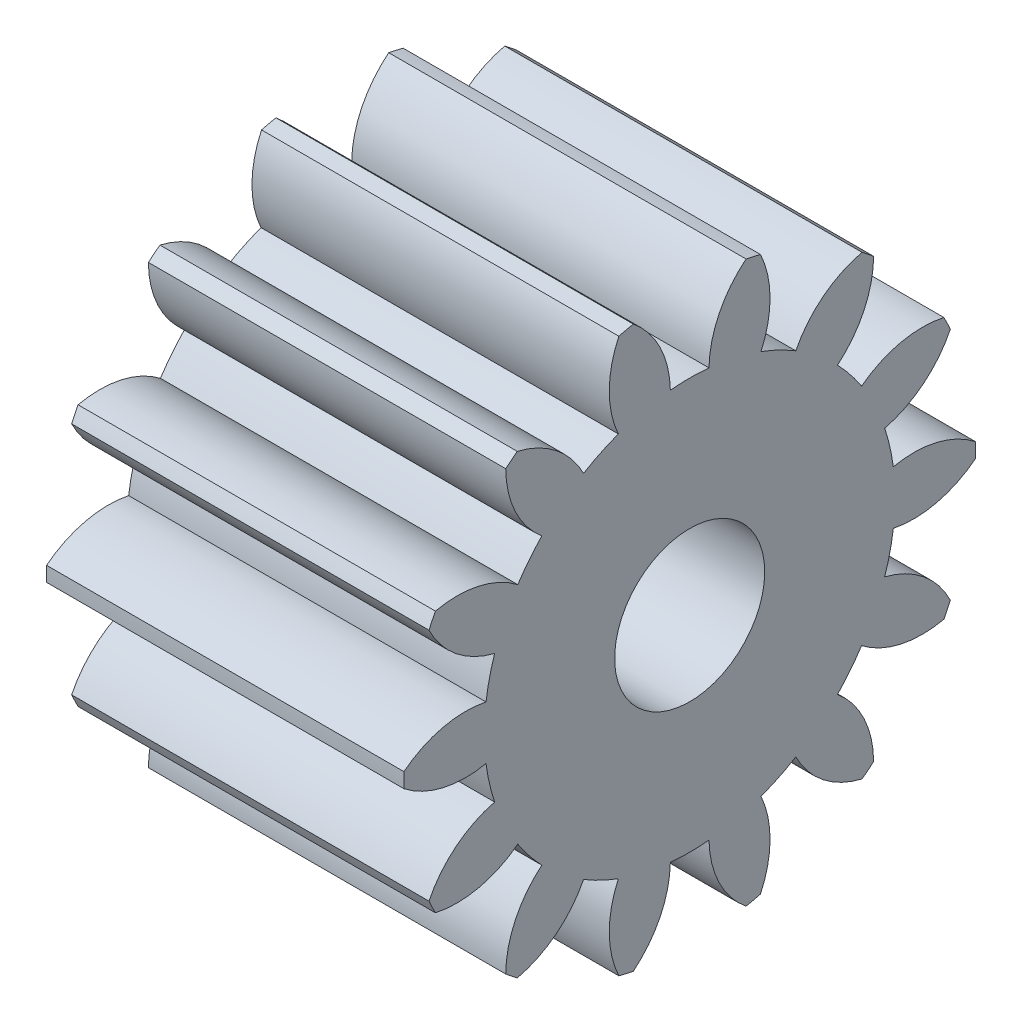
from build123d import *

# Parameters (mm, degrees)
SPUR_START             = 15.199213342
SPUR_GEAR_AM_OUTLINE_R = 2.5
SPUR_GEAR_AM_DEPTH     = 5
SKETCH9_R              = 2.5
SKETCH9_R_2            = 1.05
BOSS_EXTRUDE1_DEPTH    = 5


# Read off the part's stored shape, not the designer's step: spur gear_am
with BuildPart() as part:
    # spur gear_am outline → spur gear_am (new body)
    with BuildSketch(Plane.YZ.offset(SPUR_START)):
        with BuildLine():
            ThreePointArc((2.747947228, -4.643773619), (2.654088149, -4.687486435), (2.561391914, -4.733613923))
            ThreePointArc((2.561391914, -4.733613923), (2.561783739, -5.337982285), (2.816889806, -5.88587111))
            ThreePointArc((2.816889806, -5.88587111), (2.597713415, -6.044378226), (2.394409068, -6.222788256))
            ThreePointArc((2.394409068, -6.222788256), (1.9170234, -5.852161498), (1.327895004, -5.717294884))
            ThreePointArc((1.327895004, -5.717294884), (1.262297175, -5.797402699), (1.198794721, -5.879181519))
            ThreePointArc((1.198794721, -5.879181519), (1.461373347, -6.423528591), (1.928936024, -6.806472991))
            ThreePointArc((1.928936024, -6.806472991), (1.800238579, -7.04438004), (1.694476903, -7.293332374))
            ThreePointArc((1.694476903, -7.293332374), (1.103558354, -7.166539081), (0.514255579, -7.300641692))
            ThreePointArc((0.514255579, -7.300641692), (0.489911456, -7.401278171), (0.468180222, -7.502511024))
            ThreePointArc((0.468180222, -7.502511024), (0.940938733, -7.879022193), (1.528351497, -8.021175333))
            ThreePointArc((1.528351497, -8.021175333), (1.515623105, -8.291361907), (1.528351497, -8.56154848))
            ThreePointArc((1.528351497, -8.56154848), (0.940938733, -8.70370162), (0.468180222, -9.080212789))
            ThreePointArc((0.468180222, -9.080212789), (0.489911456, -9.181445642), (0.514255579, -9.28208212))
            ThreePointArc((0.514255579, -9.28208212), (1.103558354, -9.416184732), (1.694476903, -9.289391439))
            ThreePointArc((1.694476903, -9.289391439), (1.800238579, -9.538343772), (1.928936024, -9.776250821))
            ThreePointArc((1.928936024, -9.776250821), (1.461373347, -10.159195221), (1.198794721, -10.703542294))
            ThreePointArc((1.198794721, -10.703542294), (1.262297175, -10.785321114), (1.327895004, -10.865428928))
            ThreePointArc((1.327895004, -10.865428928), (1.9170234, -10.730562315), (2.394409068, -10.359935556))
            ThreePointArc((2.394409068, -10.359935556), (2.597713414, -10.538345587), (2.816889806, -10.696852703))
            ThreePointArc((2.816889806, -10.696852703), (2.561783739, -11.244741528), (2.561391914, -11.84910989))
            ThreePointArc((2.561391914, -11.84910989), (2.654088149, -11.895237378), (2.747947228, -11.938950194))
            ThreePointArc((2.747947228, -11.938950194), (3.220217142, -11.561826343), (3.489517843, -11.020773293))
            ThreePointArc((3.489517843, -11.020773293), (3.750097941, -11.093304726), (4.016342706, -11.14101763))
            ThreePointArc((4.016342706, -11.14101763), (4.024220134, -11.745334779), (4.286092716, -12.290021864))
            ThreePointArc((4.286092716, -12.290021864), (4.389623105, -12.291361906), (4.493153494, -12.290021864))
            ThreePointArc((4.493153494, -12.290021864), (4.755026076, -11.745334779), (4.762903504, -11.14101763))
            ThreePointArc((4.762903504, -11.14101763), (5.029148269, -11.093304726), (5.289728367, -11.020773293))
            ThreePointArc((5.289728367, -11.020773293), (5.559029068, -11.561826343), (6.031298982, -11.938950194))
            ThreePointArc((6.031298982, -11.938950194), (6.125158061, -11.895237378), (6.217854296, -11.84910989))
            ThreePointArc((6.217854296, -11.84910989), (6.217462471, -11.244741528), (5.962356404, -10.696852703))
            ThreePointArc((5.962356404, -10.696852703), (6.181532796, -10.538345587), (6.384837142, -10.359935556))
            ThreePointArc((6.384837142, -10.359935556), (6.86222281, -10.730562315), (7.451351206, -10.865428928))
            ThreePointArc((7.451351206, -10.865428928), (7.516949035, -10.785321114), (7.580451489, -10.703542294))
            ThreePointArc((7.580451489, -10.703542294), (7.317872863, -10.159195221), (6.850310186, -9.776250821))
            ThreePointArc((6.850310186, -9.776250821), (6.979007631, -9.538343772), (7.084769307, -9.289391439))
            ThreePointArc((7.084769307, -9.289391439), (7.675687856, -9.416184732), (8.26499063, -9.28208212))
            ThreePointArc((8.26499063, -9.28208212), (8.289334754, -9.181445642), (8.311065988, -9.080212789))
            ThreePointArc((8.311065988, -9.080212789), (7.838307477, -8.70370162), (7.250894713, -8.56154848))
            ThreePointArc((7.250894713, -8.56154848), (7.263623105, -8.291361907), (7.250894713, -8.021175333))
            ThreePointArc((7.250894713, -8.021175333), (7.838307477, -7.879022193), (8.311065988, -7.502511024))
            ThreePointArc((8.311065988, -7.502511024), (8.289334754, -7.40127817), (8.26499063, -7.300641692))
            ThreePointArc((8.26499063, -7.300641692), (7.675687856, -7.166539081), (7.084769307, -7.293332374))
            ThreePointArc((7.084769307, -7.293332374), (6.979007631, -7.04438004), (6.850310186, -6.806472991))
            ThreePointArc((6.850310186, -6.806472991), (7.317872863, -6.423528591), (7.580451489, -5.879181519))
            ThreePointArc((7.580451489, -5.879181519), (7.516949035, -5.797402699), (7.451351206, -5.717294884))
            ThreePointArc((7.451351206, -5.717294884), (6.86222281, -5.852161498), (6.384837142, -6.222788256))
            ThreePointArc((6.384837142, -6.222788256), (6.181532795, -6.044378226), (5.962356404, -5.88587111))
            ThreePointArc((5.962356404, -5.88587111), (6.217462471, -5.337982285), (6.217854296, -4.733613923))
            ThreePointArc((6.217854296, -4.733613923), (6.125158061, -4.687486435), (6.031298982, -4.643773619))
            ThreePointArc((6.031298982, -4.643773619), (5.559029068, -5.02089747), (5.289728367, -5.56195052))
            ThreePointArc((5.289728367, -5.56195052), (5.029148269, -5.489419087), (4.762903504, -5.441706183))
            ThreePointArc((4.762903504, -5.441706183), (4.755026076, -4.837389034), (4.493153494, -4.292701948))
            ThreePointArc((4.493153494, -4.292701948), (4.389623105, -4.291361906), (4.286092716, -4.292701948))
            ThreePointArc((4.286092716, -4.292701948), (4.024220134, -4.837389034), (4.016342706, -5.441706183))
            ThreePointArc((4.016342706, -5.441706183), (3.750097941, -5.489419087), (3.489517843, -5.56195052))
            ThreePointArc((3.489517843, -5.56195052), (3.220217142, -5.02089747), (2.747947228, -4.643773619))
        make_face()
        with Locations((4.389623105, -8.291361906)):
            Circle(SPUR_GEAR_AM_OUTLINE_R, mode=Mode.SUBTRACT)
    extrude(amount=SPUR_GEAR_AM_DEPTH)

    # Sketch9 → Boss-Extrude1 (add, through all)
    with BuildSketch(Plane(origin=(20.199213342, 0, 0), x_dir=(0, 0, -1), z_dir=(1, 0, 0))):
        with Locations((8.291361906, 4.389623105)):
            Circle(SKETCH9_R)
        with Locations((8.291361906, 4.389623105)):
            Circle(SKETCH9_R_2, mode=Mode.SUBTRACT)
    extrude(amount=-BOSS_EXTRUDE1_DEPTH)


solid = part.part
